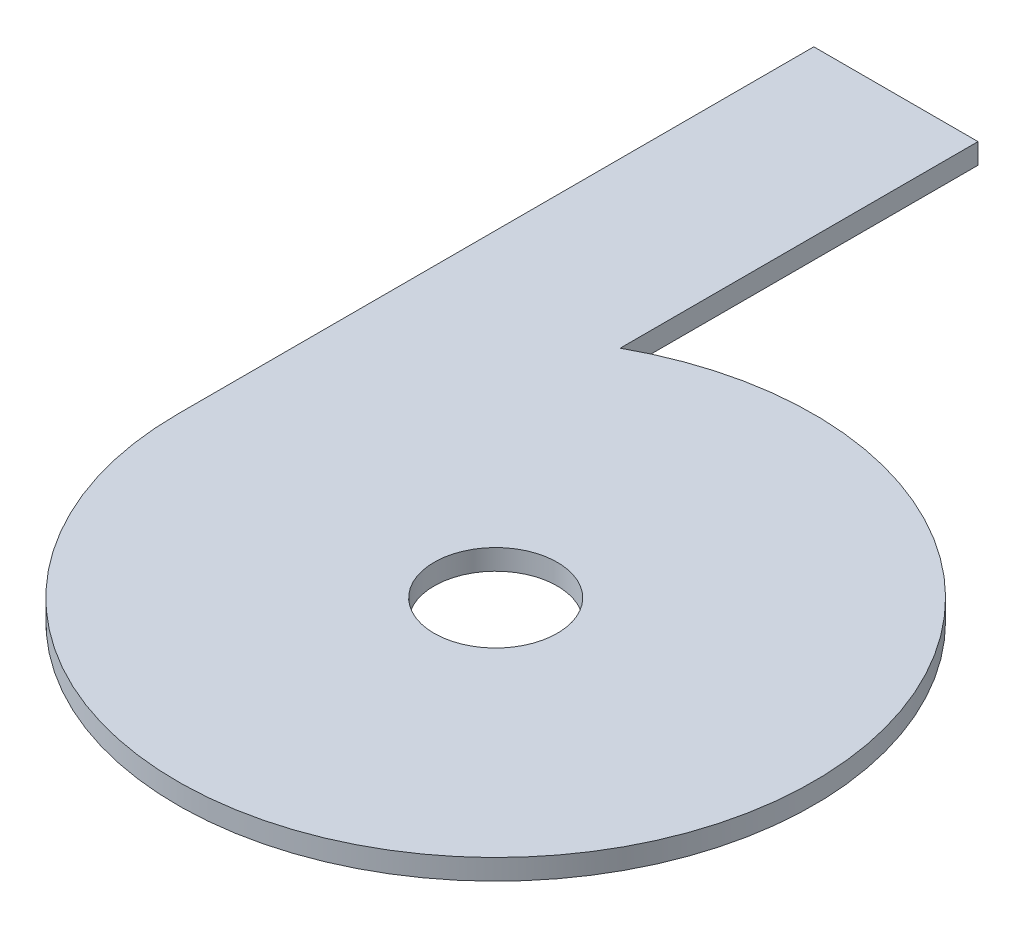
from build123d import *

# Parameters (mm, degrees)
SKETCH1_R           = 31
BOSS_EXTRUDE1_DEPTH = 2
SKETCH2_R           = 6
CUT_EXTRUDE1_DEPTH  = 2
SKETCH3_W           = 16
SKETCH3_H           = 62
BOSS_EXTRUDE2_DEPTH = 2


with BuildPart() as part:
    # Sketch1 → Boss-Extrude1 (new body)
    with BuildSketch(Plane(origin=(0, 0, 0), x_dir=(1, 0, 0), z_dir=(0, 1, 0))):
        Circle(SKETCH1_R)
    extrude(amount=BOSS_EXTRUDE1_DEPTH)

    # Sketch2 → Cut-Extrude1 (cut)
    with BuildSketch(Plane(origin=(0, 2, 0), x_dir=(1, 0, 0), z_dir=(0, 1, 0))):
        Circle(SKETCH2_R)
    extrude(amount=-CUT_EXTRUDE1_DEPTH, mode=Mode.SUBTRACT)

    # Sketch3 → Boss-Extrude2 (add)
    with BuildSketch(Plane(origin=(0, 2, 0), x_dir=(1, 0, 0), z_dir=(0, 1, 0))):
        with Locations((-23, 31)):
            Rectangle(SKETCH3_W, SKETCH3_H)
    extrude(amount=-BOSS_EXTRUDE2_DEPTH)


solid = part.part
